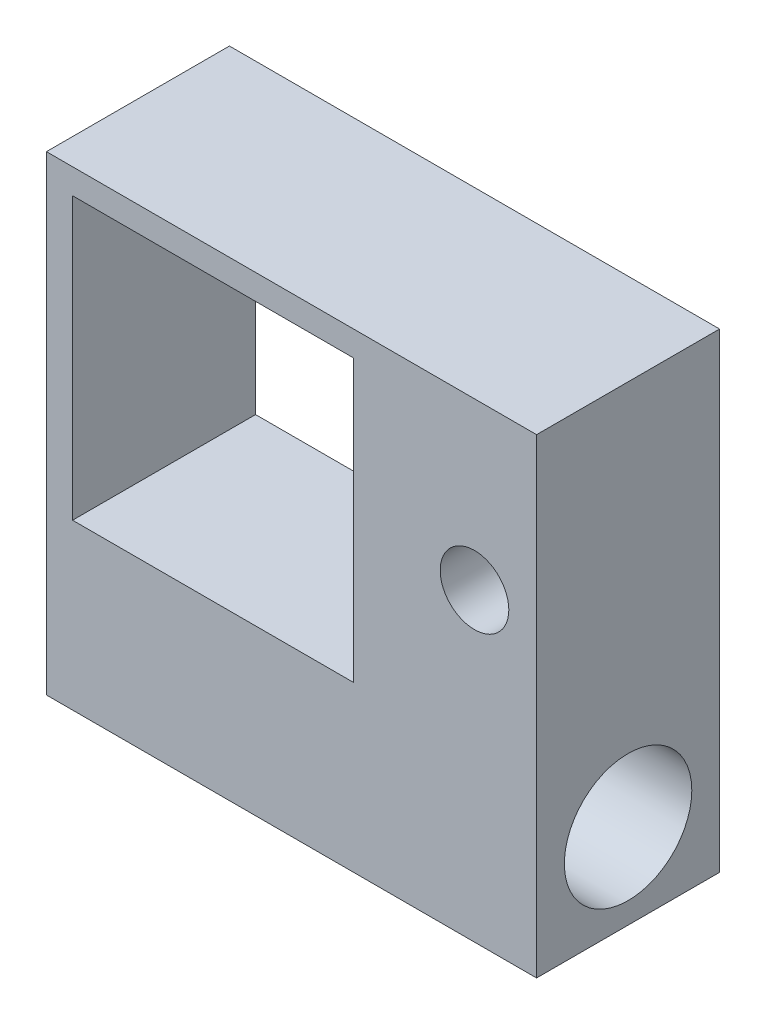
from build123d import *

# Parameters (mm, degrees)
SKETCH1_W           = 75
SKETCH1_H           = 72
SKETCH1_R           = 5.25
SKETCH1_W_2         = 43
SKETCH1_H_2         = 43
BOSS_EXTRUDE1_DEPTH = 28
SKETCH2_R           = 9.75
CUT_EXTRUDE1_DEPTH  = 88.778129395


with BuildPart() as part:
    # Sketch1 → Boss-Extrude1 (new body)
    with BuildSketch(Plane.XY):
        Rectangle(SKETCH1_W, SKETCH1_H)
        with Locations((28, 10.66)):
            Circle(SKETCH1_R, mode=Mode.SUBTRACT)
        with Locations((-12, 10.66)):
            Rectangle(SKETCH1_W_2, SKETCH1_H_2, mode=Mode.SUBTRACT)
    extrude(amount=BOSS_EXTRUDE1_DEPTH)

    # Sketch2 → Cut-Extrude1 (cut, through all)
    with BuildSketch(Plane(origin=(37.5, 0, 0), x_dir=(0, 0, -1), z_dir=(1, 0, 0))):
        with Locations((-14, -23)):
            Circle(SKETCH2_R)
    extrude(amount=-CUT_EXTRUDE1_DEPTH, mode=Mode.SUBTRACT)


solid = part.part
